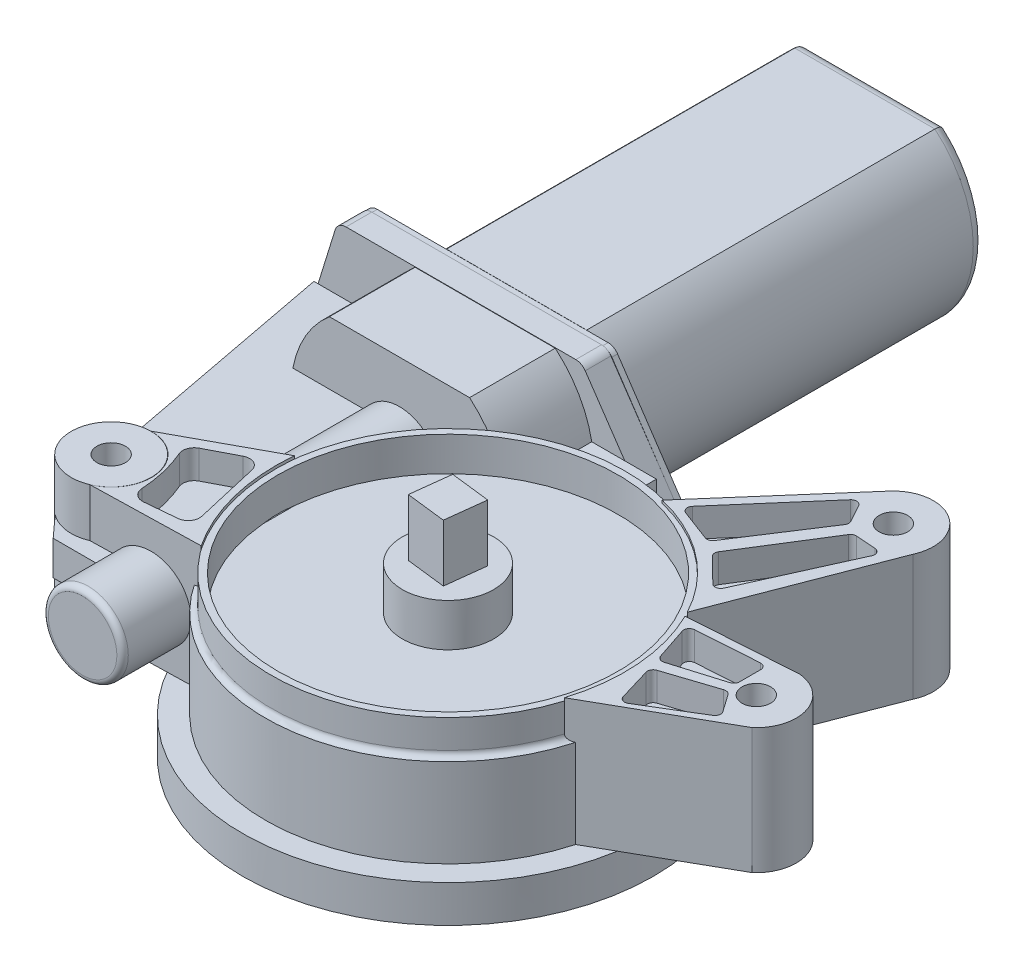
from build123d import *

# Parameters (mm, degrees)
EXTRUDE_1_DEPTH      = 63
SKETCH_4_R           = 6.75
EXTRUDE_2_DEPTH      = 5
SKETCH_5_R           = 2.5
EXTRUDE_3_DEPTH      = 2
EXTRUDE_3_TAPER      = 33
EXTRUDE_4_DEPTH      = 1
SKETCH_8_R           = 36
EXTRUDE_5_DEPTH      = 6.5
SKETCH_10_R          = 32
EXTRUDE_6_DEPTH      = 15.5
SKETCH_11_R          = 31
SKETCH_11_R_2        = 29.8
EXTRUDE_7_DEPTH      = 6
FILLET_1_R           = 1
CUT_EXTRUDE_8_DEPTH  = 1.2
SKETCH_13_R          = 8
EXTRUDE_9_DEPTH      = 7.5
EXTRUDE_10_DEPTH     = 10
SKETCH_15_R          = 7
EXTRUDE_11_DEPTH     = 75
EXTRUDE_12_DEPTH     = 19.5
EXTRUDE_13_DEPTH     = 4.5
FILLET_2_R           = 1
SKETCH_19_R          = 7
SKETCH_19_R_2        = 2.5
EXTRUDE_16_DEPTH     = 22
EXTRUDE_15_DEPTH     = 6
EXTRUDE_21_DEPTH     = 22
CUT_EXTRUDE_23_DEPTH = 5
CUT_EXTRUDE_24_DEPTH = 5
SKETCH_23_R          = 2.5
EXTRUDE_27_DEPTH     = 22
CUT_EXTRUDE_28_DEPTH = 5
CUT_EXTRUDE_29_DEPTH = 5
SKETCH_26_R          = 2.5
EXTRUDE_30_DEPTH     = 22
CUT_EXTRUDE_31_DEPTH = 5
CUT_EXTRUDE_START    = -5
CUT_EXTRUDE_32_DEPTH = 5
FILLET_3_R           = 2
FILLET_4_R           = 1
FILLET_5_R           = 0.5


with BuildPart() as part:
    # Эскиз3 → Вытянуть1 (new body)
    with BuildSketch(Plane.XY):
        with BuildLine():
            Line((-12.278029158, 14.5), (12.278029158, 14.5))
            ThreePointArc((12.278029158, 14.5), (19, 0), (12.278029158, -14.5))
            Line((12.278029158, -14.5), (-12.278029158, -14.5))
            ThreePointArc((-12.278029158, -14.5), (-19, 0), (-12.278029158, 14.5))
        make_face()
    extrude(amount=EXTRUDE_1_DEPTH)

    # Эскиз4 → Вытянуть2 (add)
    with BuildSketch(Plane(origin=(0, 0, 0), x_dir=(-1, 0, 0), z_dir=(0, 0, -1))):
        with Locations(Location((0, 0, 0), (0, 0, 180))):
            Circle(SKETCH_4_R)
    extrude(amount=EXTRUDE_2_DEPTH)

    # Эскиз5 → Вытянуть3 (add)
    with BuildSketch(Plane(origin=(0, 0, -5), x_dir=(-1, 0, 0), z_dir=(0, 0, -1))):
        Circle(SKETCH_5_R)
    extrude(amount=EXTRUDE_3_DEPTH, taper=EXTRUDE_3_TAPER)

    # Эскиз7 → Вытянуть4 (add)
    with BuildSketch(Plane.XY.offset(63)):
        with BuildLine():
            Line((-29.999706673, 1.118049021), (-26.306141783, 13.063338146))
            ThreePointArc((-26.306141783, 13.063338146), (-25.582490106, 14.082124232), (-24.395398999, 14.472523442))
            Line((-24.395398999, 14.472523442), (16.040695039, 14.472523442))
            ThreePointArc((16.040695039, 14.472523442), (16.980716844, 14.237844661), (17.700135478, 13.588882447))
            Line((17.700135478, 13.588882447), (29.659147112, -4.187896724))
            ThreePointArc((29.659147112, -4.187896724), (29.91267307, -4.720680918), (29.999706673, -5.304255729))
            Line((29.999706673, -5.304255729), (29.999706673, -12.472523442))
            ThreePointArc((29.999706673, -12.472523442), (29.413920235, -13.886737004), (27.999706673, -14.472523442))
            Line((27.999706673, -14.472523442), (-24.395398999, -14.472523442))
            ThreePointArc((-24.395398999, -14.472523442), (-25.582490106, -14.082124232), (-26.306141783, -13.063338146))
            Line((-26.306141783, -13.063338146), (-29.999706673, -1.118049021))
            Line((-29.999706673, -1.118049021), (-29.999706673, 1.118049021))
        make_face()
    extrude(amount=EXTRUDE_4_DEPTH)



with BuildPart() as body_2:
    # Эскиз8 → Вытянуть5 (new body)
    with BuildSketch(Plane.XZ.offset(16.5)):
        with Locations(Location((34, 109, 0), (0, 0, 270))):
            Circle(SKETCH_8_R)
    extrude(amount=-EXTRUDE_5_DEPTH)

    # Эскиз10 → Вытянуть6 (add)
    with BuildSketch(Plane(origin=(0, -10, 0), x_dir=(-1, 0, 0), z_dir=(0, -1, 0))):
        with Locations(Location((-34, -109, 0), (0, 0, 90))):
            Circle(SKETCH_10_R)
    extrude(amount=-EXTRUDE_6_DEPTH)

    # Эскиз11 → Вытянуть7 (add)
    with BuildSketch(Plane(origin=(0, 5.5, 0), x_dir=(1, 0, 0), z_dir=(0, 1, 0))):
        with Locations(Location((34, -109, 0), (0, 0, 90))):
            Circle(SKETCH_11_R)
        with Locations(Location((34, -109, 0), (0, 0, 270))):
            Circle(SKETCH_11_R_2, mode=Mode.SUBTRACT)
    extrude(amount=EXTRUDE_7_DEPTH)

    # Скругление1
    fillet_1_edges = [body_2.edges().sort_by_distance(p)[0] for p in [
        (34, 5.5, 140),
    ]]
    fillet(fillet_1_edges, radius=FILLET_1_R - 0.0001)  # a hair under: the kernel refuses the full size

    # Эскиз12 → Вытянуть8 (cut)
    with BuildSketch(Plane(origin=(0, -16.5, 0), x_dir=(-1, 0, 0), z_dir=(0, 1, 0))):
        with BuildLine():
            Line((-44.537249008, 139.463465118), (-23.462750992, 139.463465118))
            ThreePointArc((-23.462750992, 139.463465118), (-21.732130982, 138.465939247), (-21.727849204, 136.468419498))
            Line((-21.727849204, 136.468419498), (-32.265098212, 118.096304917))
            ThreePointArc((-32.265098212, 118.096304917), (-34, 117.091350537), (-35.734901788, 118.096304917))
            Line((-35.734901788, 118.096304917), (-46.272150796, 136.468419498))
            ThreePointArc((-46.272150796, 136.468419498), (-46.267869018, 138.465939247), (-44.537249008, 139.463465118))
        make_face()
        with BuildLine():
            Line((-16.347726311, 133.362204097), (-26.989819755, 115.05062148))
            ThreePointArc((-26.989819755, 115.05062148), (-26.992684884, 113.045675269), (-25.254917967, 112.045683437))
            Line((-25.254917967, 112.045683437), (-4.075575515, 112.106215401))
            ThreePointArc((-4.075575515, 112.106215401), (-2.347813556, 113.108683404), (-2.349240816, 115.106207232))
            Line((-2.349240816, 115.106207232), (-12.886489824, 133.357257886))
            ThreePointArc((-12.886489824, 133.357257886), (-14.615682574, 134.357255844), (-16.347726311, 133.362204097))
        make_face()
        with BuildLine():
            Line((-4.075575515, 105.893784599), (-25.254917967, 105.954316563))
            ThreePointArc((-25.254917967, 105.954316563), (-26.992684884, 104.954324731), (-26.989819755, 102.94937852))
            Line((-26.989819755, 102.94937852), (-16.347726311, 84.637795903))
            ThreePointArc((-16.347726311, 84.637795903), (-14.615682574, 83.642744156), (-12.886489824, 84.642742114))
            Line((-12.886489824, 84.642742114), (-2.349240816, 102.893792768))
            ThreePointArc((-2.349240816, 102.893792768), (-2.347813556, 104.891316596), (-4.075575515, 105.893784599))
        make_face()
        with BuildLine():
            Line((-21.727849204, 81.531580502), (-32.265098212, 99.903695083))
            ThreePointArc((-32.265098212, 99.903695083), (-34, 100.908649462), (-35.734901788, 99.903695083))
            Line((-35.734901788, 99.903695083), (-46.272150796, 81.531580502))
            ThreePointArc((-46.272150796, 81.531580502), (-46.267869018, 79.534060753), (-44.537249008, 78.536534882))
            Line((-44.537249008, 78.536534882), (-23.462750992, 78.536534882))
            ThreePointArc((-23.462750992, 78.536534882), (-21.732130982, 79.534060753), (-21.727849204, 81.531580502))
        make_face()
        with BuildLine():
            Line((-51.652273689, 84.637795903), (-41.010180245, 102.94937852))
            ThreePointArc((-41.010180245, 102.94937852), (-41.007315116, 104.954324731), (-42.745082033, 105.954316563))
            Line((-42.745082033, 105.954316563), (-63.924424485, 105.893784599))
            ThreePointArc((-63.924424485, 105.893784599), (-65.652186444, 104.891316596), (-65.650759184, 102.893792768))
            Line((-65.650759184, 102.893792768), (-55.113510176, 84.642742114))
            ThreePointArc((-55.113510176, 84.642742114), (-53.384317426, 83.642744156), (-51.652273689, 84.637795903))
        make_face()
        with BuildLine():
            Line((-63.924424485, 112.106215401), (-42.745082033, 112.045683437))
            ThreePointArc((-42.745082033, 112.045683437), (-41.007315116, 113.045675269), (-41.010180245, 115.05062148))
            Line((-41.010180245, 115.05062148), (-51.652273689, 133.362204097))
            ThreePointArc((-51.652273689, 133.362204097), (-53.384317426, 134.357255844), (-55.113510176, 133.357257886))
            Line((-55.113510176, 133.357257886), (-65.650759184, 115.106207232))
            ThreePointArc((-65.650759184, 115.106207232), (-65.652186444, 113.108683404), (-63.924424485, 112.106215401))
        make_face()
    extrude(amount=CUT_EXTRUDE_8_DEPTH, mode=Mode.SUBTRACT)

    # Эскиз13 → Вытянуть9 (add)
    with BuildSketch(Plane(origin=(0, 5.5, 0), x_dir=(1, 0, 0), z_dir=(0, 1, 0))):
        with Locations(Location((34, -109, 0), (0, 0, 90))):
            Circle(SKETCH_13_R)
    extrude(amount=EXTRUDE_9_DEPTH)

    # Эскиз14 → Вытянуть10 (add)
    with BuildSketch(Plane(origin=(0, 13, 0), x_dir=(1, 0, 0), z_dir=(0, 1, 0))):
        Polygon((30.935130682, -105.113282096), (30.113282096, -112.064869318), (37.064869318, -112.886717904), (37.886717904, -105.935130682), align=None)
    extrude(amount=EXTRUDE_10_DEPTH)


with BuildPart() as part_1:
    add(part.part)

    add(body_2.part)  # Вытянуть11 merges body 2
    # Эскиз15 → Вытянуть11 (add)
    with BuildSketch(Plane.XY.offset(64)):
        Circle(SKETCH_15_R)
    extrude(amount=EXTRUDE_11_DEPTH)

    # Эскиз16 → Вытянуть12 (add)
    with BuildSketch(Plane.XY.offset(64)):
        with BuildLine():
            Line((12.278029158, 14.5), (-12.278029158, 14.5))
            ThreePointArc((-12.278029158, 14.5), (-19, 0), (-12.278029158, -14.5))
            Line((-12.278029158, -14.5), (12.278029158, -14.5))
            ThreePointArc((12.278029158, -14.5), (19, 0), (12.278029158, 14.5))
        make_face()
    extrude(amount=EXTRUDE_12_DEPTH)

    # Эскиз17 → Вытянуть13 (add)
    with BuildSketch(Plane.XY.offset(64)):
        with BuildLine():
            Line((-26.271558155, 13.165363121), (-29.989882528, 1.149821105))
            Line((-29.989882528, 1.149821105), (-29.989882528, -1.131539983))
            Line((-29.989882528, -1.131539983), (-26.306141783, -13.063338146))
            ThreePointArc((-26.306141783, -13.063338146), (-25.582582797, -14.082693888), (-24.395143672, -14.473349822))
            Line((-24.395143672, -14.473349822), (28.000506735, -14.473349822))
            ThreePointArc((28.000506735, -14.473349822), (29.414720298, -13.887563384), (30.000506735, -12.473349822))
            Line((30.000506735, -12.473349822), (30.000506735, -5.270458835))
            ThreePointArc((30.000506735, -5.270458835), (29.912160169, -4.682597329), (29.654925585, -4.146671368))
            Line((29.654925585, -4.146671368), (17.533750692, 13.697895152))
            ThreePointArc((17.533750692, 13.697895152), (16.815394091, 14.341531649), (15.879331843, 14.574107685))
            Line((15.879331843, 14.574107685), (-24.360951704, 14.574107685))
            ThreePointArc((-24.360951704, 14.574107685), (-25.547857161, 14.183845377), (-26.271558155, 13.165363121))
        make_face()
    extrude(amount=EXTRUDE_13_DEPTH)

    # Скругление2
    fillet_2_edges = [part_1.edges().sort_by_distance(p)[0] for p in [
        (-7, 0, 139),
    ]]
    fillet(fillet_2_edges, radius=FILLET_2_R)

    # Эскиз19 → Вытянуть16 (add)
    with BuildSketch(Plane(origin=(0, -10, 0), x_dir=(-1, 0, 0), z_dir=(0, 1, 0))):
        with Locations(Location((13, 121, 0), (0, 0, 90))):
            Circle(SKETCH_19_R)
        with Locations(Location((13, 121, 0), (0, 0, 90))):
            Circle(SKETCH_19_R_2, mode=Mode.SUBTRACT)
    extrude(amount=EXTRUDE_16_DEPTH)

    # Эскиз18 → Вытянуть15 (add)
    with BuildSketch(Plane.XZ.offset(2.5)):
        with BuildLine():
            Line((-29.989882528, 68.5), (-20, 121))
            ThreePointArc((-20, 121), (-6.730902758, 117.8857714), (-17.229022921, 126.578114837))
            Line((-17.229022921, 126.578114837), (-13.852985081, 130.304291064))
            Line((-13.852985081, 130.304291064), (2.198699647, 130.304291064))
            Line((2.198699647, 130.304291064), (2.198699647, 112.560519039))
            ThreePointArc((2.198699647, 112.560519039), (8.858079937, 89.203943434), (30.000506735, 77.250920429))
            Line((30.000506735, 77.250920429), (30.000506735, 68.5))
            Line((30.000506735, 68.5), (-29.989882528, 68.5))
        make_face()
    extrude(amount=-EXTRUDE_15_DEPTH)


with BuildPart() as body_2_2:
    # Эскиз20 → Вытянуть21 (new body)
    with BuildSketch(Plane(origin=(0, -10, 0), x_dir=(-1, 0, 0), z_dir=(0, 1, 0))):
        with BuildLine():
            Line((13.033631741, 113.982002633), (-3.239124064, 105.157017873))
            ThreePointArc((-3.239124064, 105.157017873), (-4.140840515, 116.536285267), (-8.747251335, 126.980508471))
            Line((-8.747251335, 126.980508471), (10.281803381, 127.450690439))
            ThreePointArc((10.281803381, 127.450690439), (6.0975253, 119.580326831), (13.033631741, 113.982002633))
        make_face()
    extrude(amount=EXTRUDE_21_DEPTH)

    # Эскиз21 → Вытянуть23 (cut)
    with BuildSketch(Plane(origin=(0, 12, 0), x_dir=(1, 0, 0), z_dir=(0, 1, 0))):
        with BuildLine():
            Line((-6.242830265, -112.344326469), (-1.173897826, -109.716852316))
            ThreePointArc((-1.173897826, -109.716852316), (0.585667476, -109.677051952), (1.695369159, -111.043147225))
            Line((1.695369159, -111.043147225), (4.319516369, -122.424622913))
            ThreePointArc((4.319516369, -122.424622913), (3.991165766, -124.046101763), (2.553971332, -124.865540556))
            Line((2.553971332, -124.865540556), (-2.9538554, -125.372537159))
            ThreePointArc((-2.9538554, -125.372537159), (-4.441633286, -124.897005627), (-5.133821257, -123.496830964))
            ThreePointArc((-5.133821257, -123.496830964), (-5.773049795, -119.114606009), (-7.160260604, -114.908877195))
            ThreePointArc((-7.160260604, -114.908877195), (-7.20556388, -113.446296639), (-6.242830265, -112.344326469))
        make_face()
    extrude(amount=-CUT_EXTRUDE_23_DEPTH, mode=Mode.SUBTRACT)


with BuildPart() as cut_extrude_24_tool:
    # Эскиз22 → Вытянуть24 (new body)
    with BuildSketch(Plane.XZ.offset(10)):
        with BuildLine():
            Line((-2.651227605, 125.399401889), (3.052333733, 125.140395034))
            ThreePointArc((3.052333733, 125.140395034), (4.596062166, 124.295080509), (4.874044378, 122.557156457))
            Line((4.874044378, 122.557156457), (1.455884681, 111.388435774))
            ThreePointArc((1.455884681, 111.388435774), (0.360785293, 110.1483692), (-1.293580994, 110.157311605))
            Line((-1.293580994, 110.157311605), (-6.316997165, 112.472153033))
            ThreePointArc((-6.316997165, 112.472153033), (-7.367684843, 113.627864363), (-7.267049879, 115.186545177))
            ThreePointArc((-7.267049879, 115.186545177), (-5.629525554, 119.301277582), (-4.728020948, 123.637150981))
            ThreePointArc((-4.728020948, 123.637150981), (-4.035964458, 124.926434535), (-2.651227605, 125.399401889))
        make_face()
    extrude(amount=-CUT_EXTRUDE_24_DEPTH)


with BuildPart() as part_2:
    add(part_1.part)

    # Вытянуть24: cut by cut_extrude_24_tool
    add(cut_extrude_24_tool.part, mode=Mode.SUBTRACT)



with BuildPart() as body_2_2_1:
    add(body_2_2.part)

    # Вытянуть24: cut by cut_extrude_24_tool
    add(cut_extrude_24_tool.part, mode=Mode.SUBTRACT)


with BuildPart() as body_3:
    # Эскиз23 → Вытянуть27 (new body)
    with BuildSketch(Plane(origin=(0, -10, 0), x_dir=(-1, 0, 0), z_dir=(0, 1, 0))):
        with BuildLine():
            Line((-60.687272244, 58.442048291), (-42.198871445, 79.683128542))
            ThreePointArc((-42.198871445, 79.683128542), (-53.382792718, 85.013413313), (-61.384829475, 94.471713294))
            Line((-61.384829475, 94.471713294), (-72.370655171, 65.900819315))
            ThreePointArc((-72.370655171, 65.900819315), (-69.766711948, 57.099840587), (-60.687272244, 58.442048291))
        make_face()
        with Locations(Location((-66, 63, 0), (0, 0, 270))):
            Circle(SKETCH_23_R, mode=Mode.SUBTRACT)
    extrude(amount=EXTRUDE_27_DEPTH)

    # Эскиз24 → Вытянуть28 (cut)
    with BuildSketch(Plane(origin=(0, 12, 0), x_dir=(1, 0, 0), z_dir=(0, 1, 0))):
        with BuildLine():
            Line((45.779885235, -77.963551082), (58.606317387, -63.141896151))
            ThreePointArc((58.606317387, -63.141896151), (59.466004138, -62.801645322), (60.237200338, -63.311633908))
            Line((60.237200338, -63.311633908), (61.930870787, -66.368502522))
            ThreePointArc((61.930870787, -66.368502522), (62.055536625, -66.888346643), (61.894600134, -67.398129859))
            Line((61.894600134, -67.398129859), (52.892784984, -81.247076244))
            ThreePointArc((52.892784984, -81.247076244), (52.365726618, -81.652371654), (51.70101888, -81.637589481))
            Line((51.70101888, -81.637589481), (46.182731429, -79.553429414))
            ThreePointArc((46.182731429, -79.553429414), (45.56668766, -78.86354757), (45.779885235, -77.963551082))
        make_face()
        with BuildLine():
            Line((55.111994251, -83.815185167), (59.325166342, -87.943671634))
            ThreePointArc((59.325166342, -87.943671634), (60.210253804, -88.212124736), (60.936916448, -87.639928714))
            Line((60.936916448, -87.639928714), (68.983234589, -69.766608345))
            ThreePointArc((68.983234589, -69.766608345), (68.930043373, -68.843568458), (68.142836339, -68.358659166))
            Line((68.142836339, -68.358659166), (64.657065292, -68.10892828))
            ThreePointArc((64.657065292, -68.10892828), (64.133038373, -68.214641428), (63.738345855, -68.575192808))
            Line((63.738345855, -68.575192808), (54.964626671, -82.569757598))
            ThreePointArc((54.964626671, -82.569757598), (54.818814286, -83.218443684), (55.111994251, -83.815185167))
        make_face()
    extrude(amount=-CUT_EXTRUDE_28_DEPTH, mode=Mode.SUBTRACT)

    # Эскиз25 → Вытянуть29 (cut)
    with BuildSketch(Plane.XZ.offset(10)):
        with BuildLine():
            Line((46.182731429, 79.553429414), (51.70101888, 81.637589481))
            ThreePointArc((51.70101888, 81.637589481), (52.365726618, 81.652371654), (52.892784984, 81.247076244))
            Line((52.892784984, 81.247076244), (61.894600134, 67.398129859))
            ThreePointArc((61.894600134, 67.398129859), (62.055536625, 66.888346643), (61.930870787, 66.368502522))
            Line((61.930870787, 66.368502522), (60.237200338, 63.311633908))
            ThreePointArc((60.237200338, 63.311633908), (59.466004138, 62.801645322), (58.606317387, 63.141896151))
            Line((58.606317387, 63.141896151), (45.779885235, 77.963551082))
            ThreePointArc((45.779885235, 77.963551082), (45.56668766, 78.86354757), (46.182731429, 79.553429414))
        make_face()
        with BuildLine():
            Line((59.325166342, 87.943671634), (55.111994251, 83.815185167))
            ThreePointArc((55.111994251, 83.815185167), (54.818814286, 83.218443684), (54.964626671, 82.569757598))
            Line((54.964626671, 82.569757598), (63.738345855, 68.575192808))
            ThreePointArc((63.738345855, 68.575192808), (64.133038373, 68.214641428), (64.657065292, 68.10892828))
            Line((64.657065292, 68.10892828), (68.142836339, 68.358659166))
            ThreePointArc((68.142836339, 68.358659166), (68.930043373, 68.843568458), (68.983234589, 69.766608345))
            Line((68.983234589, 69.766608345), (60.936916448, 87.639928714))
            ThreePointArc((60.936916448, 87.639928714), (60.210253804, 88.212124736), (59.325166342, 87.943671634))
        make_face()
    extrude(amount=-CUT_EXTRUDE_29_DEPTH, mode=Mode.SUBTRACT)


with BuildPart() as part_3:
    add(part_2.part)

    add(body_3.part)  # Вытянуть30 merges body 3
    # Эскиз26 → Вытянуть30 (add)
    with BuildSketch(Plane(origin=(0, -10, 0), x_dir=(-1, 0, 0), z_dir=(0, 1, 0))):
        with BuildLine():
            Line((-80.667283591, 94.031877397), (-61.798629742, 95.280080741))
            ThreePointArc((-61.798629742, 95.280080741), (-64.904726914, 106.571450154), (-63.600457047, 118.209394258))
            Line((-63.600457047, 118.209394258), (-84.547217028, 106.321918573))
            ThreePointArc((-84.547217028, 106.321918573), (-86.675255216, 98.892639614), (-80.667283591, 94.031877397))
        make_face()
        with Locations(Location((-80, 101, 0), (0, 0, 270))):
            Circle(SKETCH_26_R, mode=Mode.SUBTRACT)
    extrude(amount=EXTRUDE_30_DEPTH)

    # Эскиз27 → Вытянуть31 (cut)
    with BuildSketch(Plane(origin=(0, 12, 0), x_dir=(1, 0, 0), z_dir=(0, 1, 0))):
        with BuildLine():
            Line((63.817747863, -97.804526135), (65.705799185, -103.468680102))
            ThreePointArc((65.705799185, -103.468680102), (66.194578879, -104.040421184), (66.943569023, -104.109755304))
            Line((66.943569023, -104.109755304), (75.82388988, -101.428074253))
            ThreePointArc((75.82388988, -101.428074253), (76.337637862, -101.066973206), (76.53480334, -100.470771285))
            Line((76.53480334, -100.470771285), (76.53480334, -96.761860564))
            ThreePointArc((76.53480334, -96.761860564), (76.217698889, -96.031344535), (75.467496003, -95.764128274))
            Line((75.467496003, -95.764128274), (64.699123824, -96.490566079))
            ThreePointArc((64.699123824, -96.490566079), (63.93596021, -96.931236434), (63.817747863, -97.804526135))
        make_face()
        with BuildLine():
            Line((67.524701183, -105.950544147), (76.335080816, -103.047317924))
            ThreePointArc((76.335080816, -103.047317924), (76.963038227, -103.047985604), (77.466786043, -103.422911054))
            Line((77.466786043, -103.422911054), (79.596331828, -106.459529813))
            ThreePointArc((79.596331828, -106.459529813), (79.756147486, -107.239701497), (79.295356968, -107.889225168))
            Line((79.295356968, -107.889225168), (70.061804018, -113.477342131))
            ThreePointArc((70.061804018, -113.477342131), (69.183954728, -113.554735203), (68.585753153, -112.907615478))
            Line((68.585753153, -112.907615478), (66.879380685, -107.186105979))
            ThreePointArc((66.879380685, -107.186105979), (66.951285564, -106.437358262), (67.524701183, -105.950544147))
        make_face()
    extrude(amount=-CUT_EXTRUDE_31_DEPTH, mode=Mode.SUBTRACT)

    # Эскиз28 → Вытянуть32 (cut)
    with BuildSketch(Plane.XZ.offset(10).offset(CUT_EXTRUDE_START)):
        with BuildLine():
            Line((65.705799185, 103.468680102), (63.817747863, 97.804526135))
            ThreePointArc((63.817747863, 97.804526135), (63.93596021, 96.931236434), (64.699123824, 96.490566079))
            Line((64.699123824, 96.490566079), (75.467496003, 95.764128274))
            ThreePointArc((75.467496003, 95.764128274), (76.217698889, 96.031344535), (76.53480334, 96.761860564))
            Line((76.53480334, 96.761860564), (76.53480334, 100.470771285))
            ThreePointArc((76.53480334, 100.470771285), (76.337637862, 101.066973206), (75.82388988, 101.428074253))
            Line((75.82388988, 101.428074253), (66.943569023, 104.109755304))
            ThreePointArc((66.943569023, 104.109755304), (66.194578879, 104.040421184), (65.705799185, 103.468680102))
        make_face()
        with BuildLine():
            Line((70.061804018, 113.477342131), (79.295356968, 107.889225168))
            ThreePointArc((79.295356968, 107.889225168), (79.756147486, 107.239701497), (79.596331828, 106.459529813))
            Line((79.596331828, 106.459529813), (77.466786043, 103.422911054))
            ThreePointArc((77.466786043, 103.422911054), (76.963038227, 103.047985604), (76.335080816, 103.047317924))
            Line((76.335080816, 103.047317924), (67.524701183, 105.950544147))
            ThreePointArc((67.524701183, 105.950544147), (66.951285564, 106.437358262), (66.879380685, 107.186105979))
            Line((66.879380685, 107.186105979), (68.585753153, 112.907615478))
            ThreePointArc((68.585753153, 112.907615478), (69.183954728, 113.554735203), (70.061804018, 113.477342131))
        make_face()
    extrude(amount=CUT_EXTRUDE_32_DEPTH, mode=Mode.SUBTRACT)

    # Скругление3
    fillet_3_edges = [part_3.edges().sort_by_distance(p)[0] for p in [
        (0, 14.5, 0),
        (19, 0, 0),
        (0, -14.5, 0),
        (-19, 0, 0),
    ]]
    fillet(fillet_3_edges, radius=FILLET_3_R)

    # Скругление4
    fillet_4_edges = [part_3.edges().sort_by_distance(p)[0] for p in [
        (-6.75, 0, -5),
    ]]
    fillet(fillet_4_edges, radius=FILLET_4_R)

    # Скругление5
    fillet_5_edges = [part_3.edges().sort_by_distance(p)[0] for p in [
        (1.201184814, 0, -7),
    ]]
    fillet(fillet_5_edges, radius=FILLET_5_R)


solid = Compound([body_2_2_1.part, part_3.part])
